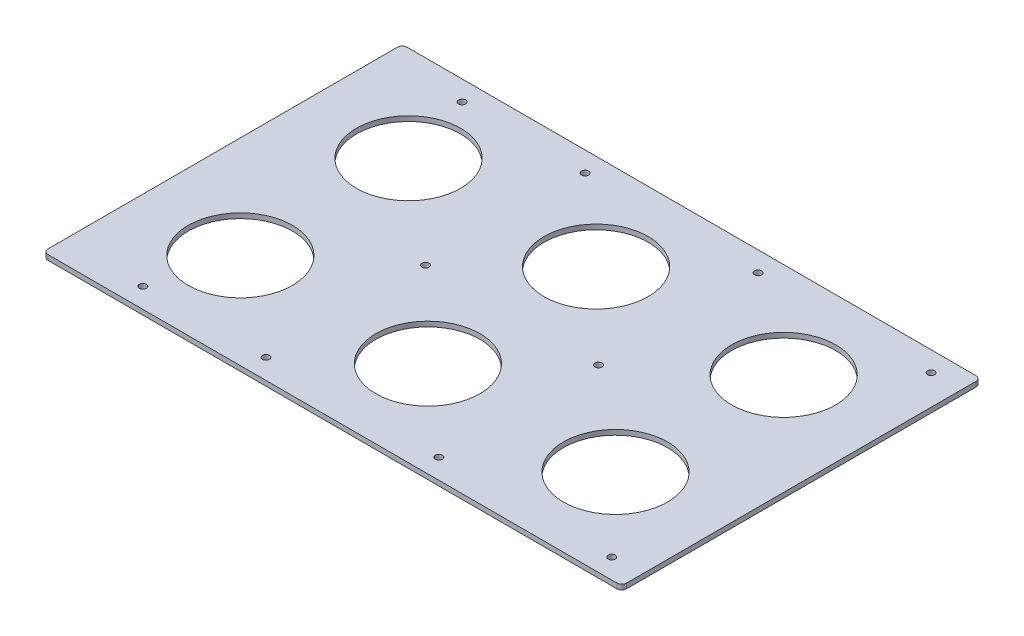
from build123d import *

# Parameters (mm, degrees)
SKETCH1_R           = 33.147
SKETCH1_R_2         = 2.2479
BOSS_EXTRUDE1_DEPTH = 3.175


with BuildPart() as part:
    # Sketch1 → Boss-Extrude1 (new body)
    with BuildSketch(Plane(origin=(0, 0, 0), x_dir=(1, 0, 0), z_dir=(0, 1, 0))):
        with BuildLine():
            Line((-180.975, 114.3), (180.975, 114.3))
            ThreePointArc((180.975, 114.3), (183.22006403, 113.37006403), (184.15, 111.125))
            Line((184.15, 111.125), (184.15, -111.125))
            ThreePointArc((184.15, -111.125), (183.22006403, -113.37006403), (180.975, -114.3))
            Line((180.975, -114.3), (-180.975, -114.3))
            ThreePointArc((-180.975, -114.3), (-183.22006403, -113.37006403), (-184.15, -111.125))
            Line((-184.15, -111.125), (-184.15, 111.125))
            ThreePointArc((-184.15, 111.125), (-183.22006403, 113.37006403), (-180.975, 114.3))
        make_face()
        with Locations((119.38, -53.5178)):
            Circle(SKETCH1_R, mode=Mode.SUBTRACT)
        with Locations((-55.033333333, -101.6)):
            Circle(SKETCH1_R_2, mode=Mode.SUBTRACT)
        with Locations((55.033333333, -101.6)):
            Circle(SKETCH1_R_2, mode=Mode.SUBTRACT)
        with Locations((165.1, -101.6)):
            Circle(SKETCH1_R_2, mode=Mode.SUBTRACT)
        with Locations((165.1, 101.6)):
            Circle(SKETCH1_R_2, mode=Mode.SUBTRACT)
        with Locations((55.033333333, 101.6)):
            Circle(SKETCH1_R_2, mode=Mode.SUBTRACT)
        with Locations((-55.033333333, 101.6)):
            Circle(SKETCH1_R_2, mode=Mode.SUBTRACT)
        with Locations((-55.033333333, 0)):
            Circle(SKETCH1_R_2, mode=Mode.SUBTRACT)
        with Locations((55.033333333, 0)):
            Circle(SKETCH1_R_2, mode=Mode.SUBTRACT)
        with Locations((119.38, 53.5178)):
            Circle(SKETCH1_R, mode=Mode.SUBTRACT)
        with Locations((0, 53.5178)):
            Circle(SKETCH1_R, mode=Mode.SUBTRACT)
        with Locations((0, -53.5178)):
            Circle(SKETCH1_R, mode=Mode.SUBTRACT)
        with Locations((-119.38, 53.5178)):
            Circle(SKETCH1_R, mode=Mode.SUBTRACT)
        with Locations((-119.38, -53.5178)):
            Circle(SKETCH1_R, mode=Mode.SUBTRACT)
        with Locations((-133.35, -101.6)):
            Circle(SKETCH1_R_2, mode=Mode.SUBTRACT)
        with Locations((-133.35, 101.6)):
            Circle(SKETCH1_R_2, mode=Mode.SUBTRACT)
    extrude(amount=BOSS_EXTRUDE1_DEPTH)


solid = part.part
